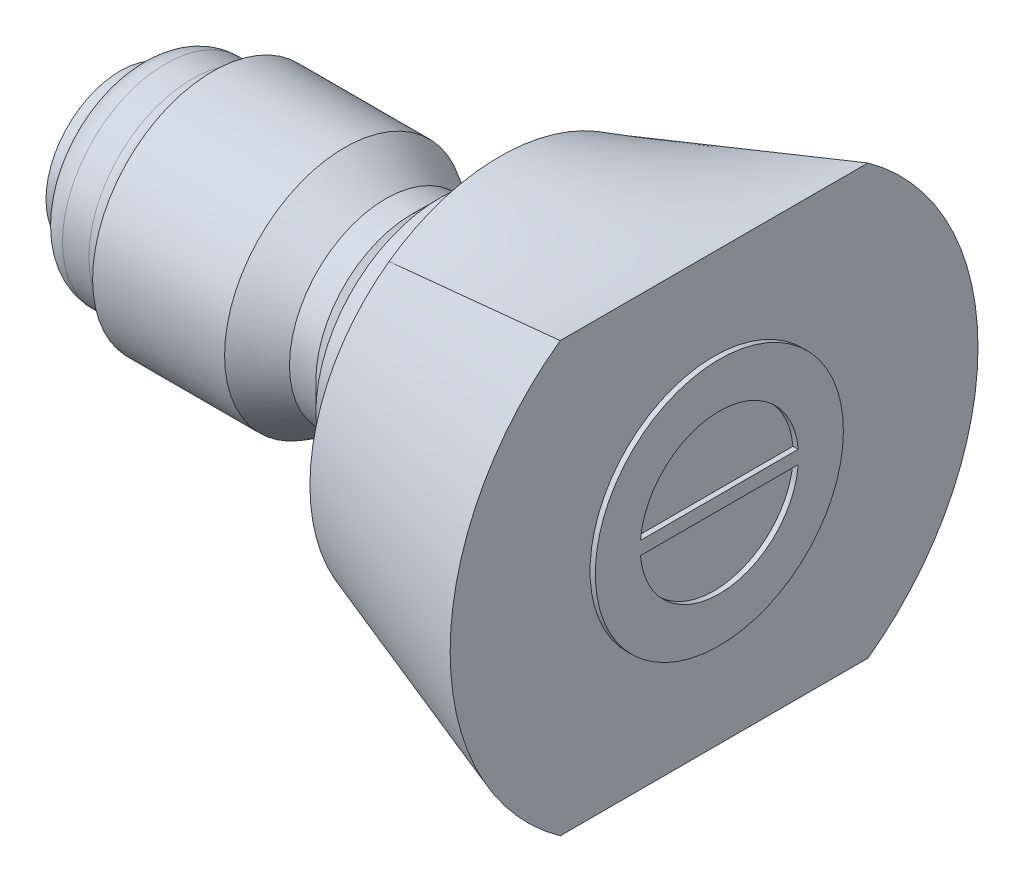
from build123d import *

# Parameters (mm, degrees)
LOFT1_OUTLINE_W     = 5.953125
LOFT1_OUTLINE_H     = 10.31875
SKETCH5_R           = 5.969
BOSS_EXTRUDE1_DEPTH = 0.254
CUT_EXTRUDE1_DEPTH  = 0.254


with BuildPart() as part:
    # Sketch1 → Revolve1 (revolve)
    with BuildSketch(Plane(origin=(0, 0, 0), x_dir=(1, 0, 0), z_dir=(0, 1, 0)), mode=Mode.PRIVATE) as revolve1_sk:
        with BuildLine():
            Line((0, 3.571875), (0.79375, 3.571875))
            ThreePointArc((0.79375, 3.571875), (1.200596987, 4.554090513), (2.1828125, 4.9609375))
            Line((2.1828125, 4.9609375), (3.4528125, 4.9609375))
            ThreePointArc((3.4528125, 4.9609375), (4.097267114, 5.191485878), (4.449245417, 5.7785))
            Line((4.449245417, 5.7785), (10.799245417, 5.7785))
            Line((10.799245417, 5.7785), (12.77897949, 4.6355))
            Line((12.77897949, 4.6355), (14.04897949, 4.6355))
            Line((14.04897949, 4.6355), (15.36660449, 5.953125))
            Line((15.36660449, 5.953125), (28.575, 5.953125))
            Line((28.575, 5.953125), (28.575, 3.175))
            Line((28.575, 3.175), (0, 3.175))
            Line((0, 3.175), (0, 3.571875))
        make_face()
    revolve(revolve1_sk.sketch.rotate(Axis((0, 0, 0), (1, 0, 0)), 180), axis=Axis((0, 0, 0), (1, 0, 0)))

    # Loft1: read off the stored shape, not the designer's step
    # Loft1 outline → Loft1 (revolve)
    with BuildSketch(Plane.YX):
        with Locations((2.9765625, 23.415625)):
            Rectangle(LOFT1_OUTLINE_W, LOFT1_OUTLINE_H)
    revolve(axis=Axis((0, 0, 0), (1, 0, 0)))

    # Loft1 2: loft between two sections, ruled curve by curve
    loft1_2_from = [
        Edge.make_bspline([(18.25625, -7.416601563, 5.32134262), (18.25625, -7.933624268, 4.60074414), (18.25625, -8.368790825, 3.767765601), (18.25625, -8.966975982, 1.956031503), (18.25625, -9.128125, 0.978637723), (18.25625, -9.128125, -0.978637723), (18.25625, -8.966975982, -1.956031503), (18.25625, -8.368790825, -3.767765601), (18.25625, -7.933624268, -4.60074414), (18.25625, -7.416601563, -5.32134262)], [0, 0, 0, 0, 0.25, 0.25, 0.5, 0.5, 0.75, 0.75, 1, 1, 1, 1], 3),
        Edge.make_bspline([(18.25625, 7.416601563, -5.32134262), (18.25625, 7.933624268, -4.60074414), (18.25625, 8.368790825, -3.767765601), (18.25625, 8.966975982, -1.956031503), (18.25625, 9.128125, -0.978637723), (18.25625, 9.128125, 0.978637723), (18.25625, 8.966975982, 1.956031503), (18.25625, 8.368790825, 3.767765601), (18.25625, 7.933624268, 4.60074414), (18.25625, 7.416601563, 5.32134262)], [0, 0, 0, 0, 0.25, 0.25, 0.5, 0.5, 0.75, 0.75, 1, 1, 1, 1], 3),
        Edge.make_three_point_arc((18.25625, -7.416601563, -5.32134262), (18.25625, 0, -9.128125), (18.25625, 7.416601563, -5.32134262)),
        Edge.make_three_point_arc((18.25625, 7.416601563, 5.32134262), (18.25625, 0, 9.128125), (18.25625, -7.416601563, 5.32134262)),
    ]
    loft1_2_to = [
        Edge.make_bspline([(28.575, -10.31875, 7.403607123), (28.575, -10.31875, 6.169672603), (28.575, -10.31875, 4.935738082), (28.575, -10.31875, 2.467869041), (28.575, -10.31875, 1.233934521), (28.575, -10.31875, -1.233934521), (28.575, -10.31875, -2.467869041), (28.575, -10.31875, -4.935738082), (28.575, -10.31875, -6.169672603), (28.575, -10.31875, -7.403607123)], [0, 0, 0, 0, 0.25, 0.25, 0.5, 0.5, 0.75, 0.75, 1, 1, 1, 1], 3),
        Edge.make_bspline([(28.575, 10.31875, -7.403607123), (28.575, 10.31875, -6.169672603), (28.575, 10.31875, -4.935738082), (28.575, 10.31875, -2.467869041), (28.575, 10.31875, -1.233934521), (28.575, 10.31875, 1.233934521), (28.575, 10.31875, 2.467869041), (28.575, 10.31875, 4.935738082), (28.575, 10.31875, 6.169672603), (28.575, 10.31875, 7.403607123)], [0, 0, 0, 0, 0.25, 0.25, 0.5, 0.5, 0.75, 0.75, 1, 1, 1, 1], 3),
        Edge.make_three_point_arc((28.575, -10.31875, -7.403607123), (28.575, 0, -12.7), (28.575, 10.31875, -7.403607123)),
        Edge.make_three_point_arc((28.575, 10.31875, 7.403607123), (28.575, 0, 12.7), (28.575, -10.31875, 7.403607123)),
    ]
    loft1_2 = Solid(Shell([*[Face.make_surface_from_curves(loft1_2_from[k], loft1_2_to[k]) for k in range(4)], Face(Wire(loft1_2_from)), Face(Wire(loft1_2_to))]))
    add(loft1_2)

    # Sketch5 → Boss-Extrude1 (add)
    with BuildSketch(Plane(origin=(28.575, 0, 0), x_dir=(0, 0, -1), z_dir=(1, 0, 0))):
        Circle(SKETCH5_R)
    extrude(amount=BOSS_EXTRUDE1_DEPTH)

    # Sketch6 → Cut-Extrude1 (cut)
    with BuildSketch(Plane(origin=(28.829, 0, 0), x_dir=(0, 0, -1), z_dir=(1, 0, 0))):
        with BuildLine():
            Line((-3.796747786, 0.3175), (3.796747786, 0.3175))
            ThreePointArc((3.796747786, 0.3175), (0, 3.81), (-3.796747786, 0.3175))
        make_face()
        with BuildLine():
            Line((-3.796747786, -0.3175), (3.796747786, -0.3175))
            ThreePointArc((3.796747786, -0.3175), (0, -3.81), (-3.796747786, -0.3175))
        make_face()
    extrude(amount=-CUT_EXTRUDE1_DEPTH, mode=Mode.SUBTRACT)


solid = part.part
